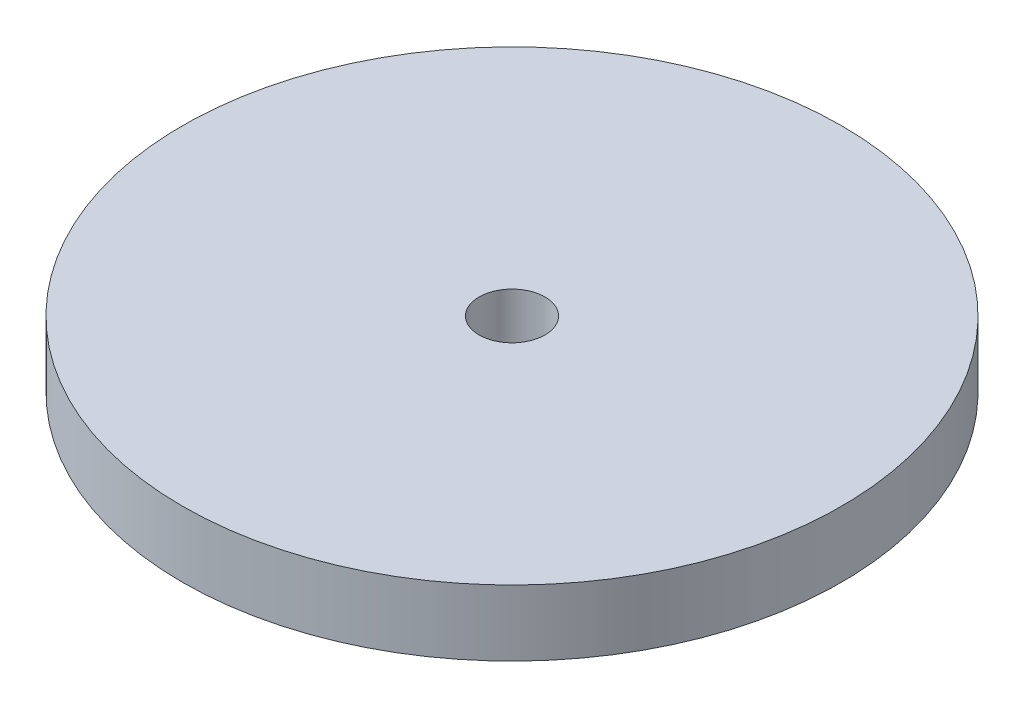
from build123d import *

# Parameters (mm, degrees)
SKETCH1_R           = 31.75
BOSS_EXTRUDE1_DEPTH = 6.35
SKETCH2_R           = 3.175
CUT_EXTRUDE1_DEPTH  = 46.348070521


with BuildPart() as part:
    # Sketch1 → Boss-Extrude1 (new body)
    with BuildSketch(Plane(origin=(0, 0, 0), x_dir=(1, 0, 0), z_dir=(0, 1, 0))):
        Circle(SKETCH1_R)
    extrude(amount=BOSS_EXTRUDE1_DEPTH)

    # Sketch2 → Cut-Extrude1 (cut, through all)
    with BuildSketch(Plane(origin=(0, 6.35, 0), x_dir=(1, 0, 0), z_dir=(0, 1, 0))):
        Circle(SKETCH2_R)
    extrude(amount=-CUT_EXTRUDE1_DEPTH, mode=Mode.SUBTRACT)


solid = part.part
